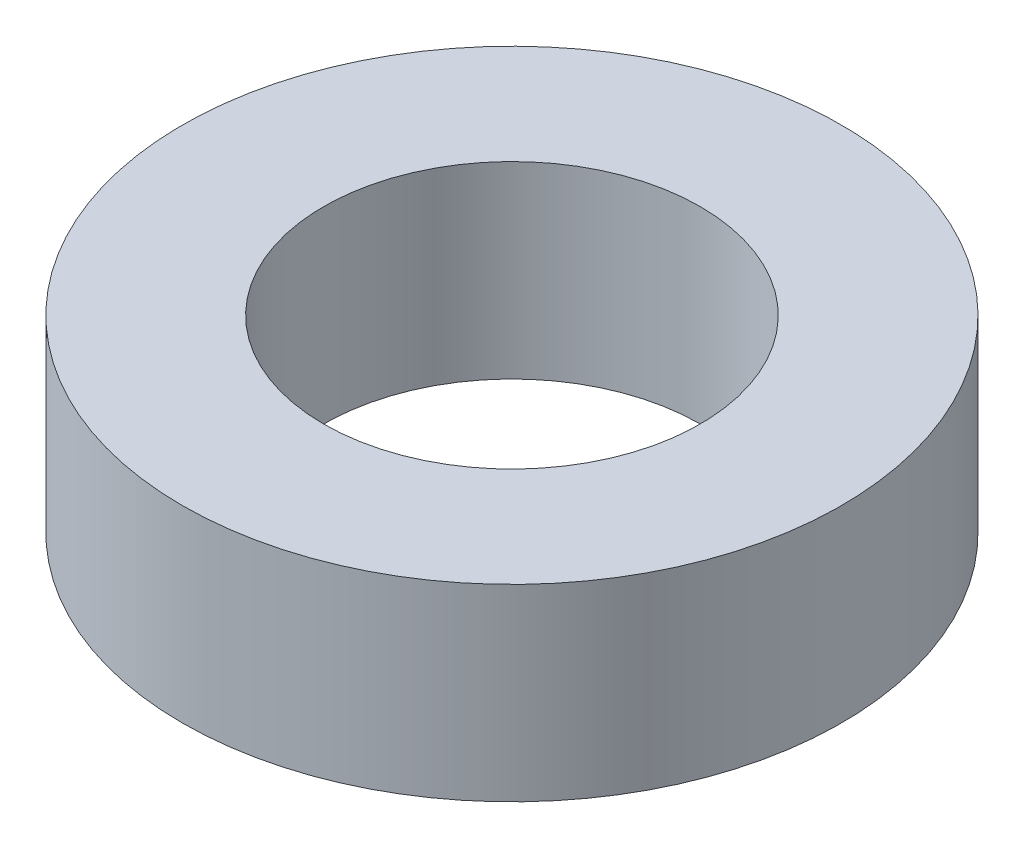
from build123d import *

# Parameters (mm, degrees)
SKIZZE1_R                       = 7
AUFSATZ_LINEAR_AUSTRAGEN1_DEPTH = 4
SKIZZE2_R                       = 4
SCHNITT_LINEAR_AUSTRAGEN1_DEPTH = 4


with BuildPart() as part:
    # Skizze1 → Aufsatz-Linear austragen1 (new body)
    with BuildSketch(Plane(origin=(0, 0, 0), x_dir=(1, 0, 0), z_dir=(0, 1, 0))):
        Circle(SKIZZE1_R)
    extrude(amount=AUFSATZ_LINEAR_AUSTRAGEN1_DEPTH)

    # Skizze2 → Schnitt-Linear austragen1 (cut)
    with BuildSketch(Plane(origin=(0, 4, 0), x_dir=(1, 0, 0), z_dir=(0, 1, 0))):
        Circle(SKIZZE2_R)
    extrude(amount=-SCHNITT_LINEAR_AUSTRAGEN1_DEPTH, mode=Mode.SUBTRACT)


solid = part.part
